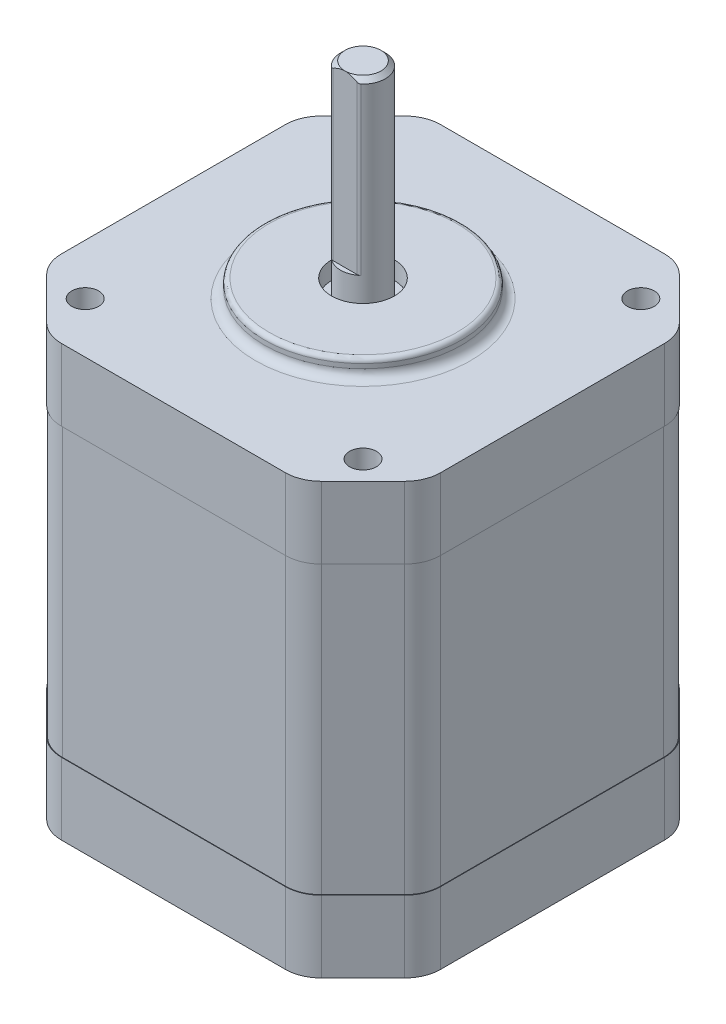
from build123d import *

# Parameters (mm, degrees)
ESBO_O1_W                  = 42.2
ESBO_O1_H                  = 42.2
RESSALTO_EXTRUS_O1_DEPTH   = 16
CHANFRO4_SIZE              = 7
FILETE3_R                  = 4
ESBO_O2_W                  = 42.3
ESBO_O2_H                  = 42.3
RESSALTO_EXTRUS_O2_DEPTH   = 8
CHANFRO5_SIZE              = 7
FILETE4_R                  = 4
CHANFRO5_OF_ESPELHAR1_SIZE = 7
FILETE4_OF_ESPELHAR1_R     = 4
ESBO_O3_R                  = 11
ESBO_O3_R_2                = 3.5
RESSALTO_EXTRUS_O3_DEPTH   = 2
FILETE5_R                  = 0.5
FILETE6_R                  = 1
ESBO_O4_R                  = 1.5
CORTE_EXTRUS_O1_DEPTH      = 10
PADR_OCIRCULAR1_COUNT      = 4
ESBO_O5_R                  = 2.5
RESSALTO_EXTRUS_O4_DEPTH   = 4
RESSALTO_EXTRUS_O5_DEPTH   = 19
CHANFRO3_SIZE              = 0.5
FILETE2_R                  = 0.5


with BuildPart() as part:
    # Esboço1 → Ressalto-extrusão1 (new, symmetric)
    with BuildSketch(Plane(origin=(0, 0, 0), x_dir=(1, 0, 0), z_dir=(0, 1, 0))):
        Rectangle(ESBO_O1_W, ESBO_O1_H)
    extrude(amount=RESSALTO_EXTRUS_O1_DEPTH, both=True)

    # Chanfro4
    chanfro4_edges = [part.edges().sort_by_distance(p)[0] for p in [
        (21.1, 0, 21.1),
        (-21.1, 0, 21.1),
        (-21.1, 0, -21.1),
        (21.1, 0, -21.1),
    ]]
    chamfer(chanfro4_edges, length=CHANFRO4_SIZE)

    # Filete3
    filete3_edges = [part.edges().sort_by_distance(p)[0] for p in [
        (14.1, 0, 21.1),
        (-14.1, 0, 21.1),
        (-21.1, 0, -14.1),
        (-21.1, 0, 14.1),
        (14.1, 0, -21.1),
        (-14.1, 0, -21.1),
        (21.1, 0, 14.1),
        (21.1, 0, -14.1),
    ]]
    fillet(filete3_edges, radius=FILETE3_R)

    # Esboço2 → Ressalto-extrusão2 (add)
    with BuildSketch(Plane(origin=(0, 16, 0), x_dir=(1, 0, 0), z_dir=(0, 1, 0))):
        Rectangle(ESBO_O2_W, ESBO_O2_H)
    ressalto_extrus_o2 = extrude(amount=RESSALTO_EXTRUS_O2_DEPTH)

    # Chanfro5
    chanfro5_edges = [part.edges().sort_by_distance(p)[0] for p in [
        (21.15, 20, 21.15),
        (21.15, 20, -21.15),
        (-21.15, 20, -21.15),
        (-21.15, 20, 21.15),
    ]]
    chamfer(chanfro5_edges, length=CHANFRO5_SIZE)

    # Filete4
    filete4_edges = [part.edges().sort_by_distance(p)[0] for p in [
        (-14.15, 20, -21.15),
        (14.15, 20, -21.15),
        (21.15, 20, 14.15),
        (21.15, 20, -14.15),
        (-14.15, 20, 21.15),
        (14.15, 20, 21.15),
        (-21.15, 20, -14.15),
        (-21.15, 20, 14.15),
    ]]
    fillet(filete4_edges, radius=FILETE4_R)

    # Espelhar1: Ressalto-extrusão2 across plane
    add(ressalto_extrus_o2.mirror(Plane.ZX))

    # Chanfro5 of Espelhar1
    chanfro5_of_espelhar1_edges = [part.edges().sort_by_distance(p)[0] for p in [
        (21.15, -20, 21.15),
        (21.15, -20, -21.15),
        (-21.15, -20, -21.15),
        (-21.15, -20, 21.15),
    ]]
    chamfer(chanfro5_of_espelhar1_edges, length=CHANFRO5_OF_ESPELHAR1_SIZE)

    # Filete4 of Espelhar1
    filete4_of_espelhar1_edges = [part.edges().sort_by_distance(p)[0] for p in [
        (-14.15, -20, -21.15),
        (14.15, -20, -21.15),
        (21.15, -20, 14.15),
        (21.15, -20, -14.15),
        (-14.15, -20, 21.15),
        (14.15, -20, 21.15),
        (-21.15, -20, -14.15),
        (-21.15, -20, 14.15),
    ]]
    fillet(filete4_of_espelhar1_edges, radius=FILETE4_OF_ESPELHAR1_R)

    # Esboço3 → Ressalto-extrusão3 (add)
    with BuildSketch(Plane(origin=(0, 24, 0), x_dir=(1, 0, 0), z_dir=(0, 1, 0))):
        with Locations(Location((0, 0, 0), (0, 0, 270))):
            Circle(ESBO_O3_R)
        with Locations(Location((0, 0, 0), (0, 0, 270))):
            Circle(ESBO_O3_R_2, mode=Mode.SUBTRACT)
    extrude(amount=RESSALTO_EXTRUS_O3_DEPTH)

    # Filete5
    filete5_edges = [part.edges().sort_by_distance(p)[0] for p in [
        (0, 26, -11),
    ]]
    fillet(filete5_edges, radius=FILETE5_R)

    # Filete6
    filete6_edges = [part.edges().sort_by_distance(p)[0] for p in [
        (0, 24, -11),
    ]]
    fillet(filete6_edges, radius=FILETE6_R)

    # Esboço4 → Corte-extrusão1 (cut)
    with BuildSketch(Plane(origin=(0, 24, 0), x_dir=(1, 0, 0), z_dir=(0, 1, 0))):
        with Locations(Location((-15.5, 15.5, 0), (0, 0, 270))):
            Circle(ESBO_O4_R)
    corte_extrus_o1 = extrude(amount=-CORTE_EXTRUS_O1_DEPTH, mode=Mode.SUBTRACT)

    # PadrãoCircular1: Corte-extrusão1 ×4 about axis
    padr_ocircular1_axis = Axis((0, 0, 0), (0, 1, 0))
    for i in range(1, PADR_OCIRCULAR1_COUNT):
        add(corte_extrus_o1.rotate(padr_ocircular1_axis, i * 360 / PADR_OCIRCULAR1_COUNT), mode=Mode.SUBTRACT)

    # Esboço5 → Ressalto-extrusão4 (add)
    with BuildSketch(Plane(origin=(0, 24, 0), x_dir=(1, 0, 0), z_dir=(0, 1, 0))):
        with Locations(Location((0, 0, 0), (0, 0, 270))):
            Circle(ESBO_O5_R)
    extrude(amount=RESSALTO_EXTRUS_O4_DEPTH)

    # Esboço6 → Ressalto-extrusão5 (add)
    with BuildSketch(Plane(origin=(0, 28, 0), x_dir=(1, 0, 0), z_dir=(0, 1, 0))):
        with BuildLine():
            ThreePointArc((2.5, 0), (-1.118033989, 2.236067977), (-1.5, -2))
            Line((-1.5, -2), (1.5, -2))
            ThreePointArc((1.5, -2), (2.236067977, -1.118033989), (2.5, 0))
        make_face()
    extrude(amount=RESSALTO_EXTRUS_O5_DEPTH)

    # Chanfro3
    chanfro3_edges = [part.edges().sort_by_distance(p)[0] for p in [
        (0, 47, -2.5),
    ]]
    chamfer(chanfro3_edges, length=CHANFRO3_SIZE - 0.0001)  # a hair under: the kernel refuses the full size

    # Filete2
    filete2_edges = [part.edges().sort_by_distance(p)[0] for p in [
        (-1.5, 37.25005, 2),
        (1.5, 37.25005, 2),
    ]]
    fillet(filete2_edges, radius=FILETE2_R)


solid = part.part
